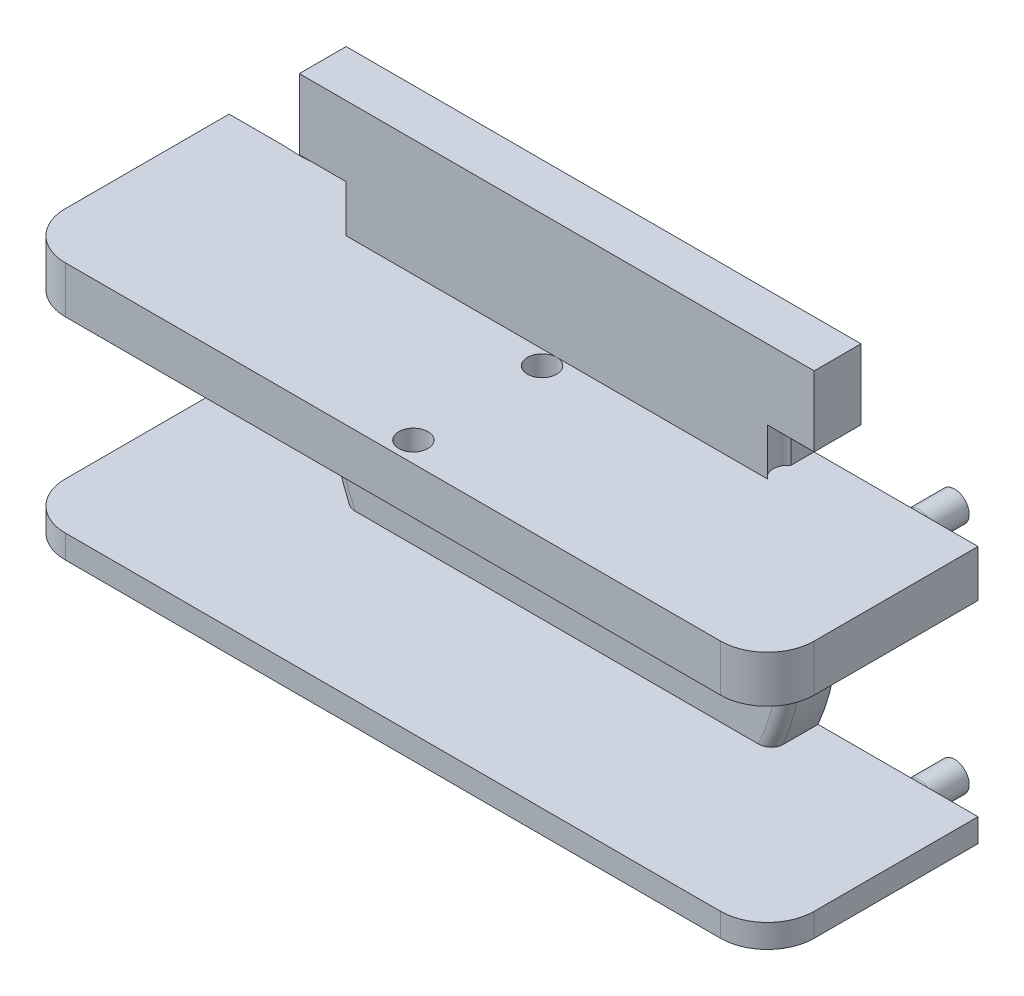
from build123d import *

# Parameters (mm, degrees)
BOSS_EXTRUDE1_DEPTH     = 2
SKETCH2_R               = 1.54
BOSS_EXTRUDE2_DEPTH     = 4
SKETCH3_R               = 3.5
BOSS_EXTRUDE3_DEPTH     = 1
SKETCH4_W               = 2
SKETCH4_H               = 17
BOSS_EXTRUDE4_DEPTH     = 0.001
SKETCH5_W               = 18
SKETCH5_H               = 2
BOSS_EXTRUDE5_DEPTH     = 0.001
SKETCH6_W               = 2.001
SKETCH6_H               = 2
BOSS_EXTRUDE6_DEPTH     = 5
BOSS_EXTRUDE7_DEPTH     = 0.001
CUT_EXTRUDE1_DEPTH      = 20.519323784
SKETCH9_W               = 2.937742252
SKETCH9_H               = 8
CUT_EXTRUDE2_DEPTH      = 0.001
CUT_EXTRUDE11_START     = -0.001
SKETCH21_R              = 9.75
SKETCH21_R_2            = 3.5
CUT_EXTRUDE11_DEPTH     = 0.001
SKETCH10_W              = 32
SKETCH10_H              = 2
BOSS_EXTRUDE8_DEPTH     = 7
FILLET1_R               = 0.5
SKETCH11_R              = 0.625
BOSS_EXTRUDE9_DEPTH     = 2
SKETCH14_W              = 2
SKETCH14_H              = 2
CUT_EXTRUDE5_DEPTH      = 22.401355237
SKETCH12_R              = 0.675
CUT_EXTRUDE3_DEPTH      = 2.5
CUT_EXTRUDE6_DEPTH      = 2
FILLET2_R               = 0.5
FILLET3_R               = 0.5
FILLET4_R               = 2
CUT_EXTRUDE7_DEPTH      = 26.019992106
CUT_EXTRUDE7_DEPTH_BACK = 1
SKETCH19_R              = 0.625
CUT_EXTRUDE9_DEPTH      = 2


with BuildPart() as part:
    # Sketch1 → Boss-Extrude1 (new body)
    with BuildSketch(Plane.XY):
        Polygon((-11, 6), (-11, 11), (11, 11), (11, 6), (11, -6), (-11, -6), align=None)
    extrude(amount=BOSS_EXTRUDE1_DEPTH)

    # Sketch3 → Boss-Extrude3 (add)
    with BuildSketch(Plane(origin=(0, 0, 0), x_dir=(-1, 0, 0), z_dir=(0, 0, -1))):
        with Locations(Location((0, 0, 0), (0, 0, 180))):
            Circle(SKETCH3_R)
    extrude(amount=BOSS_EXTRUDE3_DEPTH)

    # Sketch4 → Boss-Extrude4 (add)
    with BuildSketch(Plane(origin=(0, 0, 0), x_dir=(-1, 0, 0), z_dir=(0, 0, -1))):
        with Locations((10, 2.5)):
            Rectangle(SKETCH4_W, SKETCH4_H)
        with Locations((-10, 2.5)):
            Rectangle(SKETCH4_W, SKETCH4_H)
    extrude(amount=BOSS_EXTRUDE4_DEPTH)

    # Sketch5 → Boss-Extrude5 (add)
    with BuildSketch(Plane(origin=(0, 0, 0), x_dir=(-1, 0, 0), z_dir=(0, 0, -1))):
        with Locations((0, 10)):
            Rectangle(SKETCH5_W, SKETCH5_H)
    extrude(amount=BOSS_EXTRUDE5_DEPTH)

    # Sketch6 → Boss-Extrude6 (add)
    with BuildSketch(Plane(origin=(11, 0, 0), x_dir=(0, 0, -1), z_dir=(1, 0, 0))):
        with Locations((-0.9995, -5)):
            Rectangle(SKETCH6_W, SKETCH6_H)
        with Locations((-0.9995, 5)):
            Rectangle(SKETCH6_W, SKETCH6_H)
    boss_extrude6 = extrude(amount=BOSS_EXTRUDE6_DEPTH)

    # Mirror1: Boss-Extrude6 across plane
    add(boss_extrude6.mirror(Plane(origin=(0, 0, 0), x_dir=(0, 0, 1), z_dir=(1, 0, 0))))

    # Sketch7 → Boss-Extrude7 (add)
    with BuildSketch(Plane(origin=(0, 0, -0.001), x_dir=(-1, 0, 0), z_dir=(0, 0, -1))):
        with BuildLine():
            ThreePointArc((-6.708203932, -6), (-8.407551231, -3.211398808), (-9, 0))
            Line((-9, 0), (-9, -6))
            Line((-9, -6), (-6.708203932, -6))
        make_face()
        with BuildLine():
            Line((-9, 9), (-9, 0))
            ThreePointArc((-9, 0), (-6.363961031, 6.363961031), (0, 9))
            Line((0, 9), (-9, 9))
        make_face()
    boss_extrude7 = extrude(amount=-BOSS_EXTRUDE7_DEPTH)

    # Sketch8 → Cut-Extrude1 (cut, through all)
    with BuildSketch(Plane(origin=(0, 0, -0.001), x_dir=(-1, 0, 0), z_dir=(0, 0, -1))):
        with BuildLine():
            Line((-11, 4), (-9.16515139, 4))
            ThreePointArc((-9.16515139, 4), (-10, 0), (-9.16515139, -4))
            Line((-9.16515139, -4), (-11, -4))
            Line((-11, -4), (-11, 4))
        make_face()
    cut_extrude1 = extrude(amount=-CUT_EXTRUDE1_DEPTH, mode=Mode.SUBTRACT)

    # Sketch9 → Cut-Extrude2 (cut)
    with BuildSketch(Plane(origin=(0, 0, -0.001), x_dir=(-1, 0, 0), z_dir=(0, 0, -1))):
        with Locations((-9.531128874, 0)):
            Rectangle(SKETCH9_W, SKETCH9_H)
    cut_extrude2 = extrude(amount=-CUT_EXTRUDE2_DEPTH, mode=Mode.SUBTRACT)

    # Mirror2: Boss-Extrude7, Cut-Extrude1, Cut-Extrude2 across plane
    add(boss_extrude7.mirror(Plane(origin=(0, 0, 0), x_dir=(0, 0, 1), z_dir=(1, 0, 0))))
    add(cut_extrude1.mirror(Plane(origin=(0, 0, 0), x_dir=(0, 0, 1), z_dir=(1, 0, 0))), mode=Mode.SUBTRACT)
    add(cut_extrude2.mirror(Plane(origin=(0, 0, 0), x_dir=(0, 0, 1), z_dir=(1, 0, 0))), mode=Mode.SUBTRACT)

    # Sketch21 → Cut-Extrude11 (cut)
    with BuildSketch(Plane(origin=(0, 0, -0.001), x_dir=(-1, 0, 0), z_dir=(0, 0, -1)).offset(CUT_EXTRUDE11_START)):
        Circle(SKETCH21_R)
        with Locations(Location((0, 0, 0), (0, 0, 180))):
            Circle(SKETCH21_R_2, mode=Mode.SUBTRACT)
    extrude(amount=CUT_EXTRUDE11_DEPTH, mode=Mode.SUBTRACT)

    # Sketch10 → Boss-Extrude8 (add)
    with BuildSketch(Plane.XY.offset(2)):
        with Locations((0, -5)):
            Rectangle(SKETCH10_W, SKETCH10_H)
        with Locations((0, 5)):
            Rectangle(SKETCH10_W, SKETCH10_H)
    extrude(amount=BOSS_EXTRUDE8_DEPTH)

    # Fillet1
    fillet1_edges = [part.edges().sort_by_distance(p)[0] for p in [
        (10, 0, 2),
        (-10, 0, 2),
    ]]
    fillet(fillet1_edges, radius=FILLET1_R)

    # Sketch11 → Boss-Extrude9 (add)
    with BuildSketch(Plane(origin=(0, 0, -0.001), x_dir=(-1, 0, 0), z_dir=(0, 0, -1))):
        with Locations(Location((-13, -5, 0), (0, 0, 180))):
            Circle(SKETCH11_R)
    boss_extrude9 = extrude(amount=BOSS_EXTRUDE9_DEPTH)

    # Sketch14 → Cut-Extrude5 (cut, through all)
    with BuildSketch(Plane(origin=(0, 0, -0.001), x_dir=(-1, 0, 0), z_dir=(0, 0, -1))):
        with Locations((10, 7)):
            Rectangle(SKETCH14_W, SKETCH14_H)
        with Locations((-10, 7)):
            Rectangle(SKETCH14_W, SKETCH14_H)
    extrude(amount=-CUT_EXTRUDE5_DEPTH, mode=Mode.SUBTRACT)

    # Sketch12 → Cut-Extrude3 (cut)
    with BuildSketch(Plane(origin=(0, 0, -0.001), x_dir=(-1, 0, 0), z_dir=(0, 0, -1))):
        with Locations((13, -5)):
            Circle(SKETCH12_R)
    cut_extrude3 = extrude(amount=-CUT_EXTRUDE3_DEPTH, mode=Mode.SUBTRACT)

    # Sketch16 → Cut-Extrude6 (cut)
    with BuildSketch(Plane(origin=(0, 6, 0), x_dir=(1, 0, 0), z_dir=(0, 1, 0))):
        with BuildLine():
            Line((-9, -1), (-9, -2))
            ThreePointArc((-9, -2), (-8.75, -1.5), (-9, -1))
        make_face()
    cut_extrude6 = extrude(amount=CUT_EXTRUDE6_DEPTH, mode=Mode.SUBTRACT)

    # Mirror3: Boss-Extrude9, Cut-Extrude3 across plane
    add(boss_extrude9.mirror(Plane.ZX))
    add(cut_extrude3.mirror(Plane.ZX), mode=Mode.SUBTRACT)

    # Mirror4: Cut-Extrude6 across plane
    add(cut_extrude6.mirror(Plane(origin=(0, 0, 0), x_dir=(0, 0, 1), z_dir=(1, 0, 0))), mode=Mode.SUBTRACT)

    # Fillet2
    fillet2_edges = [part.edges().sort_by_distance(p)[0] for p in [
        (12.375, -5, -0.001),
        (12.375, 5, -0.001),
    ]]
    fillet(fillet2_edges, radius=FILLET2_R)

    # Fillet3
    # the kernel refuses this fillet: 0.5 mm, written as the material it takes off along each edge
    with BuildSketch(Plane(origin=(-13, -5, -0.001), x_dir=(-1, 0, 0), z_dir=(0, -1, 0))) as fillet3_piece_1:
        with BuildLine():
            CenterArc((0.675 + FILLET3_R, -FILLET3_R), FILLET3_R, 90, 90)
            Line((0.675, -FILLET3_R), (0.675, 0))
            Line((0.675, 0), (0.675 + FILLET3_R, 0))
        make_face()
    revolve(axis=Axis((-13, -5, -0.001), (0, 0, -1)), mode=Mode.SUBTRACT)
    with BuildSketch(Plane(origin=(-13, 5, -0.001), x_dir=(-1, 0, 0), z_dir=(0, 1, 0))) as fillet3_piece_2:
        with BuildLine():
            CenterArc((0.675 + FILLET3_R, FILLET3_R), FILLET3_R, 180, 90)
            Line((0.675, FILLET3_R), (0.675, 0))
            Line((0.675, 0), (0.675 + FILLET3_R, 0))
        make_face()
    revolve(axis=Axis((-13, 5, -0.001), (0, 0, 1)), mode=Mode.SUBTRACT)

    # Fillet4
    fillet4_edges = [part.edges().sort_by_distance(p)[0] for p in [
        (16, -5, 9),
        (-16, -5, 9),
        (-16, 5, 9),
        (16, 5, 9),
    ]]
    fillet(fillet4_edges, radius=FILLET4_R)

    # Sketch17 → Cut-Extrude7 (cut, two sides: drawn at the far end of the back side and taken through both)
    with BuildSketch(Plane.XZ.offset(6).offset(-CUT_EXTRUDE7_DEPTH_BACK)):
        with BuildLine():
            Line((-16, 7), (-16, -0.001))
            Line((-16, -0.001), (-14.5, -0.001))
            Line((-14.5, -0.001), (-14.5, 7))
            ThreePointArc((-14.5, 7), (-14.353553391, 7.353553391), (-14, 7.5))
            Line((-14, 7.5), (14, 7.5))
            ThreePointArc((14, 7.5), (14.353553391, 7.353553391), (14.5, 7))
            Line((14.5, 7), (14.5, -0.001))
            Line((14.5, -0.001), (16, -0.001))
            Line((16, -0.001), (16, 7))
            ThreePointArc((16, 7), (15.414213562, 8.414213562), (14, 9))
            Line((14, 9), (-14, 9))
            ThreePointArc((-14, 9), (-15.414213562, 8.414213562), (-16, 7))
        make_face()
    extrude(amount=CUT_EXTRUDE7_DEPTH + CUT_EXTRUDE7_DEPTH_BACK, mode=Mode.SUBTRACT)

    # Sketch19 → Cut-Extrude9 (cut)
    with BuildSketch(Plane(origin=(0, 6, 0), x_dir=(1, 0, 0), z_dir=(0, 1, 0))):
        with Locations(Location((0, -2.625, 0), (0, 0, 90))):
            Circle(SKETCH19_R)
        with Locations(Location((0, -8.125, 0), (0, 0, 270))):
            Circle(SKETCH19_R)
    extrude(amount=-CUT_EXTRUDE9_DEPTH, mode=Mode.SUBTRACT)


with BuildPart() as body_2:
    # Sketch2 → Boss-Extrude2 (new body)
    with BuildSketch(Plane(origin=(0, 0, 2), x_dir=(-1, 0, 0), z_dir=(0, 0, -1))):
        Circle(SKETCH2_R)
    extrude(amount=BOSS_EXTRUDE2_DEPTH)


with BuildPart() as part_1:
    add(part.part)

    # Combine2: cut body 2
    add(body_2.part, mode=Mode.SUBTRACT)


solid = part_1.part
